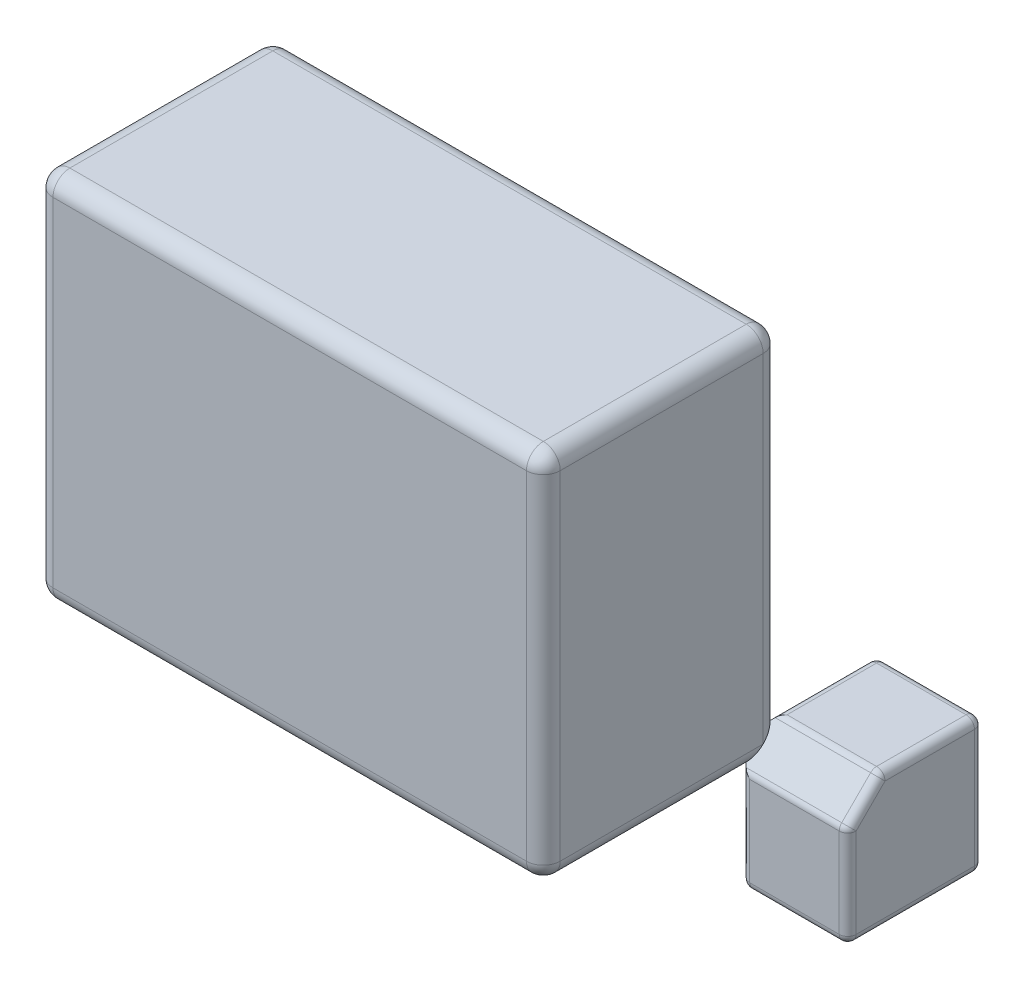
from build123d import *

# Parameters (mm, degrees)
SKETCH1_W                = 30
SKETCH1_H                = 22
BOSS_EXTRUDE1_DEPTH      = 14
SHELL1_T                 = 1
BOSS_EXTRUDE3_DEPTH      = 6
BOSS_EXTRUDE3_DEPTH_BACK = 2
SKETCH2_W                = 8
SKETCH2_H                = 8
CHAMFER2_SIZE            = 2
FILLET1_R                = 1
FILLET2_R                = 0.5


with BuildPart() as part:
    # Sketch1 → Boss-Extrude1 (new body)
    with BuildSketch(Plane.XY):
        with Locations((15, 11)):
            Rectangle(SKETCH1_W, SKETCH1_H)
    extrude(amount=BOSS_EXTRUDE1_DEPTH)

    # Shell1 (no face opened: a closed hollow body)
    add(offset(amount=-SHELL1_T, mode=Mode.PRIVATE), mode=Mode.SUBTRACT)

    # Sketch2 → Boss-Extrude3 (add, two sides: drawn at the far end of the back side and taken through both)
    with BuildSketch(Plane(origin=(0, 0, 0), x_dir=(-1, 0, 0), z_dir=(0, 0, -1)).offset(-BOSS_EXTRUDE3_DEPTH_BACK)):
        with Locations((-32, -2)):
            Rectangle(SKETCH2_W, SKETCH2_H)
    extrude(amount=BOSS_EXTRUDE3_DEPTH + BOSS_EXTRUDE3_DEPTH_BACK)

    # Chamfer2
    chamfer2_edges = [part.edges().sort_by_distance(p)[0] for p in [
        (28, -3, 2),
        (28, 2, -3),
        (33, 2, 2),
    ]]
    chamfer(chamfer2_edges, length=CHAMFER2_SIZE)

    # Fillet1
    # the kernel refuses this fillet: 1 mm, written as the material it takes off along each edge
    with BuildSketch(Plane(origin=(1, 21, 1), x_dir=(0, 1, 0), z_dir=(0, 0, -1))) as fillet1_piece_1_section:
        Polygon((0, 0), (FILLET1_R, 0), (FILLET1_R, -FILLET1_R), (0, -FILLET1_R), align=None)
    fillet1_piece_1 = extrude(amount=FILLET1_R, mode=Mode.PRIVATE)
    fillet1_piece_1 = fillet1_piece_1 - Plane(origin=(1, 21, 1), x_dir=(0.7071067811865475, -0.7071067811865477, 0), z_dir=(0, 0, -1)) * Sphere(FILLET1_R, mode=Mode.PRIVATE)
    add(fillet1_piece_1, mode=Mode.SUBTRACT)
    with BuildSketch(Plane(origin=(1, 1, 1), x_dir=(0, 0, -1), z_dir=(0, -1, 0))) as fillet1_piece_2_section:
        Polygon((0, 0), (FILLET1_R, 0), (FILLET1_R, -FILLET1_R), (0, -FILLET1_R), align=None)
    fillet1_piece_2 = extrude(amount=FILLET1_R, mode=Mode.PRIVATE)
    fillet1_piece_2 = fillet1_piece_2 - Plane(origin=(1, 1, 1), x_dir=(0.7071067811865475, 0, 0.7071067811865475), z_dir=(0, -1, 0)) * Sphere(FILLET1_R, mode=Mode.PRIVATE)
    add(fillet1_piece_2, mode=Mode.SUBTRACT)
    with BuildSketch(Plane(origin=(29, 21, 1), x_dir=(0, 0, -1), z_dir=(0, 1, 0))) as fillet1_piece_3_section:
        Polygon((0, 0), (FILLET1_R, 0), (FILLET1_R, -FILLET1_R), (0, -FILLET1_R), align=None)
    fillet1_piece_3 = extrude(amount=FILLET1_R, mode=Mode.PRIVATE)
    fillet1_piece_3 = fillet1_piece_3 - Plane(origin=(29, 21, 1), x_dir=(-0.7071067811865475, 0, 0.7071067811865475), z_dir=(0, 1, 0)) * Sphere(FILLET1_R, mode=Mode.PRIVATE)
    add(fillet1_piece_3, mode=Mode.SUBTRACT)
    with BuildSketch(Plane(origin=(1, 1, 13), x_dir=(-1, 0, 0), z_dir=(0, -1, 0))) as fillet1_piece_4_section:
        Polygon((0, 0), (FILLET1_R, 0), (FILLET1_R, -FILLET1_R), (0, -FILLET1_R), align=None)
    fillet1_piece_4 = extrude(amount=FILLET1_R, mode=Mode.PRIVATE)
    fillet1_piece_4 = fillet1_piece_4 - Plane(origin=(1, 1, 13), x_dir=(0.7071067811865475, 0, -0.7071067811865475), z_dir=(0, -1, 0)) * Sphere(FILLET1_R, mode=Mode.PRIVATE)
    add(fillet1_piece_4, mode=Mode.SUBTRACT)
    with BuildSketch(Plane(origin=(29, 1, 13), x_dir=(1, 0, 0), z_dir=(0, -1, 0))) as fillet1_piece_5_section:
        Polygon((0, 0), (FILLET1_R, 0), (FILLET1_R, FILLET1_R), (0, FILLET1_R), align=None)
    fillet1_piece_5 = extrude(amount=FILLET1_R, mode=Mode.PRIVATE)
    fillet1_piece_5 = fillet1_piece_5 - Plane(origin=(29, 1, 13), x_dir=(-0.7071067811865475, 0, -0.7071067811865475), z_dir=(0, -1, 0)) * Sphere(FILLET1_R, mode=Mode.PRIVATE)
    add(fillet1_piece_5, mode=Mode.SUBTRACT)
    with BuildSketch(Plane(origin=(29, 21, 13), x_dir=(1, 0, 0), z_dir=(0, 1, 0))) as fillet1_piece_6_section:
        Polygon((0, 0), (FILLET1_R, 0), (FILLET1_R, -FILLET1_R), (0, -FILLET1_R), align=None)
    fillet1_piece_6 = extrude(amount=FILLET1_R, mode=Mode.PRIVATE)
    fillet1_piece_6 = fillet1_piece_6 - Plane(origin=(29, 21, 13), x_dir=(-0.7071067811865475, 0, -0.7071067811865475), z_dir=(0, 1, 0)) * Sphere(FILLET1_R, mode=Mode.PRIVATE)
    add(fillet1_piece_6, mode=Mode.SUBTRACT)
    with BuildSketch(Plane(origin=(1, 21, 13), x_dir=(-1, 0, 0), z_dir=(0, 1, 0))) as fillet1_piece_7_section:
        Polygon((0, 0), (FILLET1_R, 0), (FILLET1_R, FILLET1_R), (0, FILLET1_R), align=None)
    fillet1_piece_7 = extrude(amount=FILLET1_R, mode=Mode.PRIVATE)
    fillet1_piece_7 = fillet1_piece_7 - Plane(origin=(1, 21, 13), x_dir=(0.7071067811865475, 0, -0.7071067811865475), z_dir=(0, 1, 0)) * Sphere(FILLET1_R, mode=Mode.PRIVATE)
    add(fillet1_piece_7, mode=Mode.SUBTRACT)
    with BuildSketch(Plane(origin=(0, 21, 0), x_dir=(1, 0, 0), z_dir=(0, -1, 0)), Plane(origin=(30, 1, 14), x_dir=(0, 0, -1), z_dir=(0, 1, 0)), Plane(origin=(0, 21, 14), x_dir=(0, 0, -1), z_dir=(0, -1, 0))) as fillet1_piece_8:
        with BuildLine():
            CenterArc((FILLET1_R, FILLET1_R), FILLET1_R, 180, 90)
            Line((0, FILLET1_R), (0, 0))
            Line((0, 0), (FILLET1_R, 0))
        make_face()
    extrude(amount=20, mode=Mode.SUBTRACT)
    with BuildSketch(Plane(origin=(1, 0, 0), x_dir=(0, 0, 1), z_dir=(1, 0, 0))) as fillet1_piece_9_section:
        with BuildLine():
            CenterArc((FILLET1_R, -FILLET1_R), FILLET1_R, 90, 90)
            Line((0, -FILLET1_R), (0, 0))
            Line((0, 0), (FILLET1_R, 0))
        make_face()
    fillet1_piece_9 = extrude(amount=29.5, mode=Mode.PRIVATE)
    fillet1_piece_9 = split(fillet1_piece_9, bisect_by=Plane(origin=(21.381816869, 0.226411675, -6.618183131), z_dir=(-0.7071067811865476, 0, 0.7071067811865476)), keep=Keep.TOP, mode=Mode.PRIVATE)
    fillet1_piece_9 = split(fillet1_piece_9, bisect_by=Plane(origin=(21.381816869, -6.618183131, 0.226411675), z_dir=(-0.7071067811865476, 0.7071067811865476, 0)), keep=Keep.TOP, mode=Mode.PRIVATE)
    add(fillet1_piece_9, mode=Mode.SUBTRACT)
    with BuildSketch(Plane(origin=(1, 0, 0), x_dir=(0, 0, 1), z_dir=(1, 0, 0))) as fillet1_piece_10_section:
        with BuildLine():
            CenterArc((FILLET1_R, -FILLET1_R), FILLET1_R, 90, 90)
            Line((0, -FILLET1_R), (0, 0))
            Line((0, 0), (FILLET1_R, 0))
        make_face()
    fillet1_piece_10 = extrude(amount=29.5, mode=Mode.PRIVATE)
    fillet1_piece_10 = split(fillet1_piece_10, bisect_by=Plane(origin=(28.16446835, 0.528927527, 0.16446835), z_dir=(0.7071067811865476, 0, -0.7071067811865476)), keep=Keep.TOP, mode=Mode.PRIVATE)
    fillet1_piece_10 = split(fillet1_piece_10, bisect_by=Plane(origin=(28.407441135, 0.407441135, 0.042981958), z_dir=(-0.7071067811865476, 0.7071067811865476, 0)), keep=Keep.TOP, mode=Mode.PRIVATE)
    add(fillet1_piece_10, mode=Mode.SUBTRACT)
    with BuildSketch(Plane(origin=(1, 0, 0), x_dir=(0, 0, 1), z_dir=(1, 0, 0))) as fillet1_piece_11_section:
        with BuildLine():
            CenterArc((FILLET1_R, -FILLET1_R), FILLET1_R, 90, 90)
            Line((0, -FILLET1_R), (0, 0))
            Line((0, 0), (FILLET1_R, 0))
        make_face()
    fillet1_piece_11 = extrude(amount=29.5, mode=Mode.PRIVATE)
    fillet1_piece_11 = split(fillet1_piece_11, bisect_by=Plane(origin=(28.407441135, 0.042981958, 0.407441135), z_dir=(-0.7071067811865476, 0, 0.7071067811865476)), keep=Keep.TOP, mode=Mode.PRIVATE)
    fillet1_piece_11 = split(fillet1_piece_11, bisect_by=Plane(origin=(28.16446835, 0.16446835, 0.528927527), z_dir=(0.7071067811865476, -0.7071067811865476, 0)), keep=Keep.TOP, mode=Mode.PRIVATE)
    add(fillet1_piece_11, mode=Mode.SUBTRACT)
    with BuildSketch(Plane(origin=(30, -0.5, 0), x_dir=(-1, 0, 0), z_dir=(0, 1, 0))) as fillet1_piece_12_section:
        with BuildLine():
            CenterArc((FILLET1_R, FILLET1_R), FILLET1_R, 180, 90)
            Line((0, FILLET1_R), (0, 0))
            Line((0, 0), (FILLET1_R, 0))
        make_face()
    fillet1_piece_12 = extrude(amount=21.5, mode=Mode.PRIVATE)
    fillet1_piece_12 = split(fillet1_piece_12, bisect_by=Plane(origin=(29.83553165, 1.83553165, 0.528927527), z_dir=(0.7071067811865476, -0.7071067811865476, 0)), keep=Keep.TOP, mode=Mode.PRIVATE)
    fillet1_piece_12 = split(fillet1_piece_12, bisect_by=Plane(origin=(29.957018042, 1.592558865, 0.407441135), z_dir=(0, 0.7071067811865476, 0.7071067811865476)), keep=Keep.TOP, mode=Mode.PRIVATE)
    add(fillet1_piece_12, mode=Mode.SUBTRACT)
    with BuildSketch(Plane(origin=(30, -0.5, 0), x_dir=(-1, 0, 0), z_dir=(0, 1, 0))) as fillet1_piece_13_section:
        with BuildLine():
            CenterArc((FILLET1_R, FILLET1_R), FILLET1_R, 180, 90)
            Line((0, FILLET1_R), (0, 0))
            Line((0, 0), (FILLET1_R, 0))
        make_face()
    fillet1_piece_13 = extrude(amount=21.5, mode=Mode.PRIVATE)
    fillet1_piece_13 = split(fillet1_piece_13, bisect_by=Plane(origin=(29.592558865, 1.592558865, 0.042981958), z_dir=(-0.7071067811865476, 0.7071067811865476, 0)), keep=Keep.TOP, mode=Mode.PRIVATE)
    fillet1_piece_13 = split(fillet1_piece_13, bisect_by=Plane(origin=(29.471072473, 1.83553165, 0.16446835), z_dir=(0, -0.7071067811865476, -0.7071067811865476)), keep=Keep.TOP, mode=Mode.PRIVATE)
    add(fillet1_piece_13, mode=Mode.SUBTRACT)
    with BuildSketch(Plane(origin=(30, -0.5, 0), x_dir=(-1, 0, 0), z_dir=(0, 1, 0))) as fillet1_piece_14_section:
        with BuildLine():
            CenterArc((FILLET1_R, FILLET1_R), FILLET1_R, 180, 90)
            Line((0, FILLET1_R), (0, 0))
            Line((0, 0), (FILLET1_R, 0))
        make_face()
    fillet1_piece_14 = extrude(amount=21.5, mode=Mode.PRIVATE)
    fillet1_piece_14 = split(fillet1_piece_14, bisect_by=Plane(origin=(34.618159496, 6.618159496, 0.226418621), z_dir=(-0.7071067811865476, 0.7071067811865476, 0)), keep=Keep.TOP, mode=Mode.PRIVATE)
    fillet1_piece_14 = split(fillet1_piece_14, bisect_by=Plane(origin=(29.773581379, 6.618159496, -4.618159496), z_dir=(0, 0.7071067811865476, 0.7071067811865476)), keep=Keep.TOP, mode=Mode.PRIVATE)
    add(fillet1_piece_14, mode=Mode.SUBTRACT)
    with BuildSketch(Plane(origin=(29, 22, 0), x_dir=(0, -1, 0), z_dir=(-1, 0, 0)), Plane(origin=(1, 0, 14), x_dir=(0, 0, -1), z_dir=(1, 0, 0))) as fillet1_piece_15:
        with BuildLine():
            CenterArc((FILLET1_R, FILLET1_R), FILLET1_R, 180, 90)
            Line((0, FILLET1_R), (0, 0))
            Line((0, 0), (FILLET1_R, 0))
        make_face()
    extrude(amount=28, mode=Mode.SUBTRACT)
    with BuildSketch(Plane(origin=(29, 22, 14), x_dir=(0, -1, 0), z_dir=(-1, 0, 0))) as fillet1_piece_16:
        with BuildLine():
            CenterArc((FILLET1_R, -FILLET1_R), FILLET1_R, 90, 90)
            Line((0, -FILLET1_R), (0, 0))
            Line((0, 0), (FILLET1_R, 0))
        make_face()
    extrude(amount=28, mode=Mode.SUBTRACT)
    with BuildSketch(Plane(origin=(0, 22, 1), x_dir=(0, -1, 0), z_dir=(0, 0, 1)), Plane(origin=(0, 0, 1), x_dir=(1, 0, 0), z_dir=(0, 0, 1))) as fillet1_piece_17:
        with BuildLine():
            CenterArc((FILLET1_R, FILLET1_R), FILLET1_R, 180, 90)
            Line((0, FILLET1_R), (0, 0))
            Line((0, 0), (FILLET1_R, 0))
        make_face()
    extrude(amount=12, mode=Mode.SUBTRACT)
    with BuildSketch(Plane(origin=(30, 22, 1), x_dir=(0, -1, 0), z_dir=(0, 0, 1))) as fillet1_piece_18:
        with BuildLine():
            CenterArc((FILLET1_R, -FILLET1_R), FILLET1_R, 90, 90)
            Line((0, -FILLET1_R), (0, 0))
            Line((0, 0), (FILLET1_R, 0))
        make_face()
    extrude(amount=12, mode=Mode.SUBTRACT)
    with BuildSketch(Plane(origin=(30, 0, -0.5), x_dir=(-1, 0, 0), z_dir=(0, 0, 1))) as fillet1_piece_19_section:
        with BuildLine():
            CenterArc((FILLET1_R, -FILLET1_R), FILLET1_R, 90, 90)
            Line((0, -FILLET1_R), (0, 0))
            Line((0, 0), (FILLET1_R, 0))
        make_face()
    fillet1_piece_19 = extrude(amount=13.5, mode=Mode.PRIVATE)
    fillet1_piece_19 = split(fillet1_piece_19, bisect_by=Plane(origin=(29.83553165, 0.528927527, 1.83553165), z_dir=(0.7071067811865476, 0, -0.7071067811865476)), keep=Keep.TOP, mode=Mode.PRIVATE)
    fillet1_piece_19 = split(fillet1_piece_19, bisect_by=Plane(origin=(29.957018042, 0.407441135, 1.592558865), z_dir=(0, 0.7071067811865476, 0.7071067811865476)), keep=Keep.TOP, mode=Mode.PRIVATE)
    add(fillet1_piece_19, mode=Mode.SUBTRACT)
    with BuildSketch(Plane(origin=(30, 0, -0.5), x_dir=(-1, 0, 0), z_dir=(0, 0, 1))) as fillet1_piece_20_section:
        with BuildLine():
            CenterArc((FILLET1_R, -FILLET1_R), FILLET1_R, 90, 90)
            Line((0, -FILLET1_R), (0, 0))
            Line((0, 0), (FILLET1_R, 0))
        make_face()
    fillet1_piece_20 = extrude(amount=13.5, mode=Mode.PRIVATE)
    fillet1_piece_20 = split(fillet1_piece_20, bisect_by=Plane(origin=(29.592558865, 0.042981958, 1.592558865), z_dir=(-0.7071067811865476, 0, 0.7071067811865476)), keep=Keep.TOP, mode=Mode.PRIVATE)
    fillet1_piece_20 = split(fillet1_piece_20, bisect_by=Plane(origin=(29.471072473, 0.16446835, 1.83553165), z_dir=(0, -0.7071067811865476, -0.7071067811865476)), keep=Keep.TOP, mode=Mode.PRIVATE)
    add(fillet1_piece_20, mode=Mode.SUBTRACT)
    with BuildSketch(Plane(origin=(30, 0, -0.5), x_dir=(-1, 0, 0), z_dir=(0, 0, 1))) as fillet1_piece_21_section:
        with BuildLine():
            CenterArc((FILLET1_R, -FILLET1_R), FILLET1_R, 90, 90)
            Line((0, -FILLET1_R), (0, 0))
            Line((0, 0), (FILLET1_R, 0))
        make_face()
    fillet1_piece_21 = extrude(amount=13.5, mode=Mode.PRIVATE)
    fillet1_piece_21 = split(fillet1_piece_21, bisect_by=Plane(origin=(32.618101716, 0.226435602, 4.618101716), z_dir=(-0.7071067811865476, 0, 0.7071067811865476)), keep=Keep.TOP, mode=Mode.PRIVATE)
    fillet1_piece_21 = split(fillet1_piece_21, bisect_by=Plane(origin=(29.773564398, -2.618101716, 4.618101716), z_dir=(0, 0.7071067811865476, 0.7071067811865476)), keep=Keep.TOP, mode=Mode.PRIVATE)
    add(fillet1_piece_21, mode=Mode.SUBTRACT)

    # Fillet2
    fillet2_edges = [part.edges().sort_by_distance(p)[0] for p in [
        (32, -6, -6),
        (36, -6, -2),
        (36, -2, -6),
        (36, 2, -3),
        (33, 2, -6),
        (30, 2, -3),
        (33, 2, 0),
        (36, -3, 2),
        (36, 1, 1),
        (33, -6, 2),
        (30, -3, 2),
        (33, 0, 2),
        (28, -3, -6),
        (28, -6, -3),
        (28, -3, 0),
        (28, 0, -3),
        (29, 1, -6),
        (29, -6, 1),
    ]]
    fillet(fillet2_edges, radius=FILLET2_R)


solid = part.part
